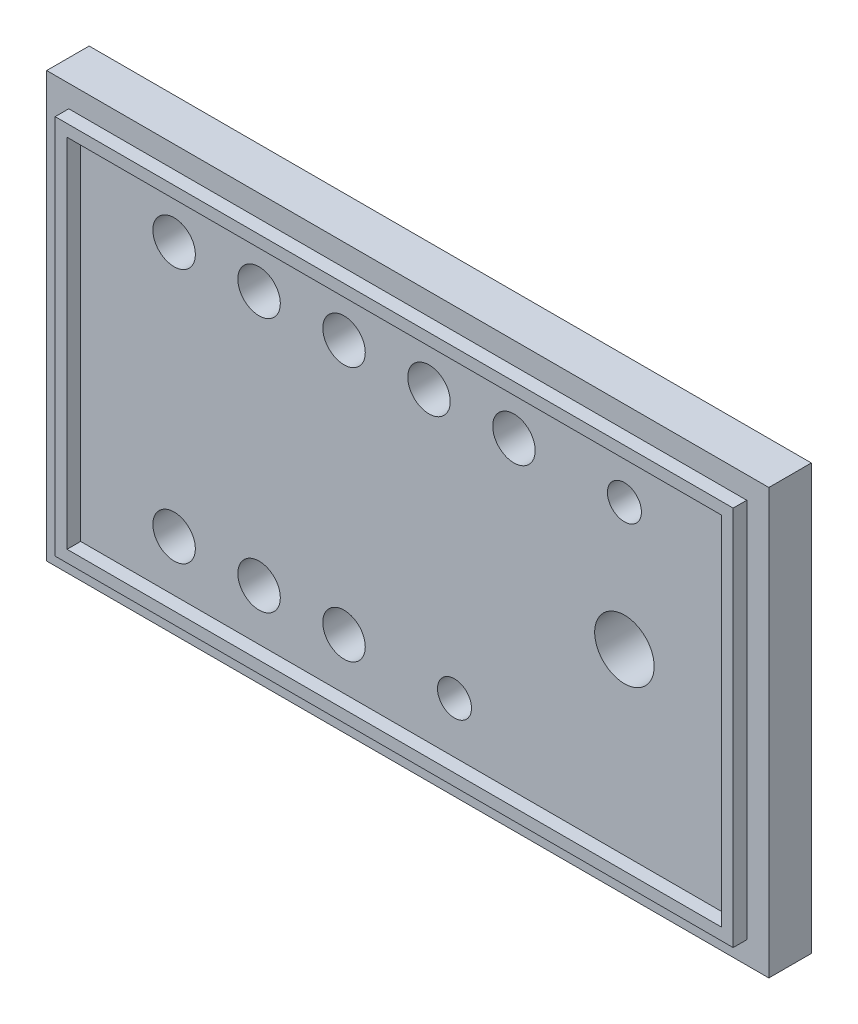
from build123d import *

# Parameters (mm, degrees)
SKICA1_W                = 85
SKICA1_H                = 50
SKICA1_R                = 3.5
SKICA1_R_2              = 2.5
SKICA1_R_3              = 2
P_IDAT_VYSUNUT_M2_DEPTH = 5
SKICA1_4_W              = 79.8
SKICA1_4_H              = 44.8
SKICA1_4_W_2            = 77
SKICA1_4_H_2            = 42
P_IDAT_VYSUNUT_M3_DEPTH = 6.6


with BuildPart() as part:
    # Skica1 → Přidat vysunutím2 (new body)
    with BuildSketch(Plane.XY):
        with Locations((42.5, 25)):
            Rectangle(SKICA1_W, SKICA1_H)
        with Locations((68, 25)):
            Circle(SKICA1_R, mode=Mode.SUBTRACT)
        with Locations((45, 40)):
            Circle(SKICA1_R_2, mode=Mode.SUBTRACT)
        with Locations((55, 40)):
            Circle(SKICA1_R_2, mode=Mode.SUBTRACT)
        with Locations((68, 40)):
            Circle(SKICA1_R_3, mode=Mode.SUBTRACT)
        with Locations((15, 10)):
            Circle(SKICA1_R_2, mode=Mode.SUBTRACT)
        with Locations((25, 10)):
            Circle(SKICA1_R_2, mode=Mode.SUBTRACT)
        with Locations((35, 10)):
            Circle(SKICA1_R_2, mode=Mode.SUBTRACT)
        with Locations((48, 10)):
            Circle(SKICA1_R_3, mode=Mode.SUBTRACT)
        with Locations((15, 40)):
            Circle(SKICA1_R_2, mode=Mode.SUBTRACT)
        with Locations((25, 40)):
            Circle(SKICA1_R_2, mode=Mode.SUBTRACT)
        with Locations((35, 40)):
            Circle(SKICA1_R_2, mode=Mode.SUBTRACT)
    extrude(amount=P_IDAT_VYSUNUT_M2_DEPTH)

    # Skica1<4> → Přidat vysunutím3 (add)
    with BuildSketch(Plane.XY):
        with Locations((42.5, 25)):
            Rectangle(SKICA1_4_W, SKICA1_4_H)
        with Locations((42.5, 25)):
            Rectangle(SKICA1_4_W_2, SKICA1_4_H_2, mode=Mode.SUBTRACT)
    extrude(amount=P_IDAT_VYSUNUT_M3_DEPTH)


solid = part.part
